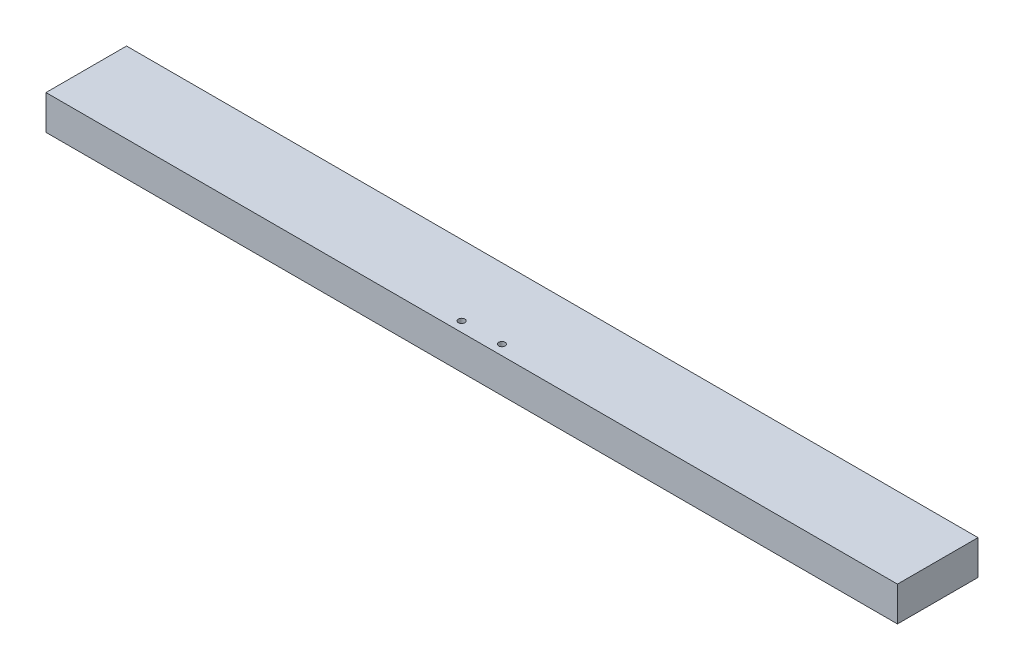
from build123d import *

# Parameters (mm, degrees)
SKETCH1_W           = 939.6984
SKETCH1_H           = 38.1
BOSS_EXTRUDE1_DEPTH = 88.9
SKETCH2_R           = 3.571875
CUT_EXTRUDE1_DEPTH  = 480.701043089


with BuildPart() as part:
    # Sketch1 → Boss-Extrude1 (new body)
    with BuildSketch(Plane.XY):
        Rectangle(SKETCH1_W, SKETCH1_H)
    extrude(amount=BOSS_EXTRUDE1_DEPTH)

    # Sketch2 → Cut-Extrude1 (cut, through all)
    with BuildSketch(Plane(origin=(0, 19.05, 0), x_dir=(1, 0, 0), z_dir=(0, 1, 0))):
        with Locations((-22.225, -77.7875)):
            Circle(SKETCH2_R)
        with Locations((22.225, -77.7875)):
            Circle(SKETCH2_R)
    extrude(amount=-CUT_EXTRUDE1_DEPTH, mode=Mode.SUBTRACT)


solid = part.part
